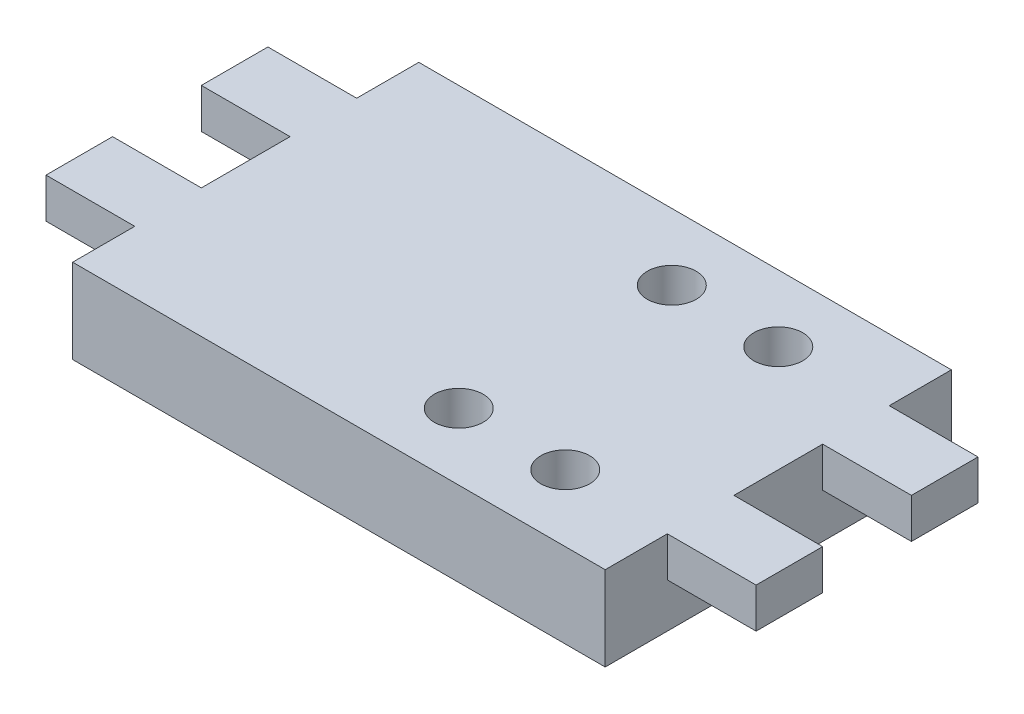
from build123d import *

# Parameters (mm, degrees)
SKETCH1_W                       = 25
SKETCH1_H                       = 4.5
BOSS_EXTRUDE1_DEPTH             = 30
SKETCH2_W                       = 7.5
SKETCH2_H                       = 4.5
BOSS_EXTRUDE2_DEPTH             = 10
ESQUISSE1_W                     = 60
ESQUISSE1_H                     = 4.5
BOSS_EXTRU_1_DEPTH              = 7
SKETCH6_W                       = 60
SKETCH6_H                       = 39
BOSS_EXTRUDE3_DEPTH             = 5
CBORE_FOR_M3_SBHCS2_D           = 2.8
CBORE_FOR_M3_SBHCS2_CBORE_D     = 5.5
CBORE_FOR_M3_SBHCS2_CBORE_DEPTH = 8.1


with BuildPart() as part:
    # Sketch1 → Boss-Extrude1 (new, symmetric)
    with BuildSketch(Plane(origin=(0, 0, 0), x_dir=(0, 0, -1), z_dir=(1, 0, 0))):
        Rectangle(SKETCH1_W, SKETCH1_H)
    extrude(amount=BOSS_EXTRUDE1_DEPTH, both=True)

    # Sketch2 → Boss-Extrude2 (add)
    with BuildSketch(Plane(origin=(30, 0, 0), x_dir=(0, 0, -1), z_dir=(1, 0, 0))):
        with Locations((-8.75, 0)):
            Rectangle(SKETCH2_W, SKETCH2_H)
        with Locations((8.75, 0)):
            Rectangle(SKETCH2_W, SKETCH2_H)
    boss_extrude2 = extrude(amount=BOSS_EXTRUDE2_DEPTH)

    # Esquisse1 → Boss.-Extru.1 (add)
    with BuildSketch(Plane.XY.offset(12.5)):
        Rectangle(ESQUISSE1_W, ESQUISSE1_H)
    boss_extru_1 = extrude(amount=BOSS_EXTRU_1_DEPTH)

    # Symétrie1: Boss.-Extru.1 across plane
    add(boss_extru_1.mirror(Plane.XY))

    # Mirror1: Boss-Extrude2 across plane
    add(boss_extrude2.mirror(Plane(origin=(0, 0, 0), x_dir=(0, 0, 1), z_dir=(1, 0, 0))))

    # Sketch6 → Boss-Extrude3 (add)
    with BuildSketch(Plane.XZ.offset(2.25)):
        Rectangle(SKETCH6_W, SKETCH6_H)
    extrude(amount=BOSS_EXTRUDE3_DEPTH)

    # CBORE for M3 SBHCS2 (through all)
    with Locations(Plane(origin=(0, 2.25, 0), x_dir=(-1, 0, 0), z_dir=(0, 1, 0))):
        with Locations((-18, -12), (-6, -12), (-6, 12), (-18, 12)):
            CounterBoreHole(CBORE_FOR_M3_SBHCS2_D / 2, CBORE_FOR_M3_SBHCS2_CBORE_D / 2, CBORE_FOR_M3_SBHCS2_CBORE_DEPTH)


solid = part.part
